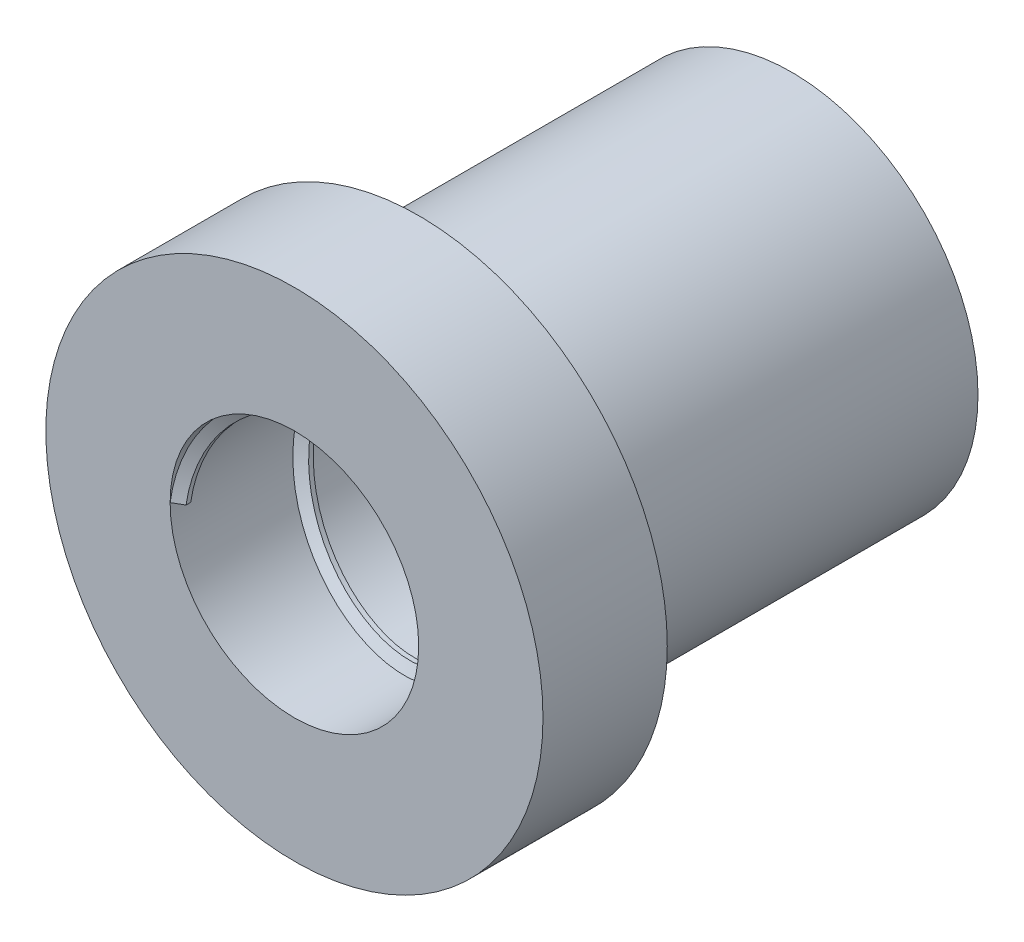
from build123d import *

# Parameters (mm, degrees)
SKETCH1_R               = 15
SKETCH1_R_2             = 10
BOSS_EXTRUDE1_DEPTH     = 30
SKETCH2_R               = 20
SKETCH2_R_2             = 10
BOSS_EXTRUDE2_DEPTH     = 10
THREAD1_PITCH           = 10
CUT_EXTRUDE1_DEPTH      = 16
CUT_EXTRUDE1_DEPTH_BACK = 17
SKETCH5_W               = 2.757537734
SKETCH5_H               = 30


with BuildPart() as part:
    # Sketch1 → Boss-Extrude1 (new body)
    with BuildSketch(Plane.XY):
        Circle(SKETCH1_R)
        Circle(SKETCH1_R_2, mode=Mode.SUBTRACT)
    extrude(amount=BOSS_EXTRUDE1_DEPTH)

    # Sketch2 → Boss-Extrude2 (add)
    with BuildSketch(Plane.XY.offset(30)):
        Circle(SKETCH2_R)
        Circle(SKETCH2_R_2, mode=Mode.SUBTRACT)
    extrude(amount=BOSS_EXTRUDE2_DEPTH)

    # Thread1: the profile of Thread Profile1 profile screwed along a right-hand helix of 4 turns, 16 arcs to a turn; built about Z, then put on its axis
    thread1_z = Axis((0, 0, 0), (0, 0, 1))
    thread1_corners = [(10.0003, 0, -0.000173205), (10.0003, 0, 1.312673201), (9.188101187, 0, 0.843749998), (9.188101187, 0, 0.468749998)]
    with BuildLine(mode=Mode.PRIVATE) as thread1_profile:
        Line(thread1_corners[0], thread1_corners[1])
        Line(thread1_corners[1], thread1_corners[2])
        Line(thread1_corners[2], thread1_corners[3])
        Line(thread1_corners[3], thread1_corners[0])
    thread1_cap = Face(thread1_profile.wire())
    thread1_turn_angles = [0, 11.25, 22.5, 33.75, 45, 56.25, 67.5, 78.75, 90, 101.25, 112.5, 123.75, 135, 146.25, 157.5, 168.75, 180, 191.25, 202.5, 213.75, 225, 236.25, 247.5, 258.75, 270, 281.25, 292.5, 303.75, 315, 326.25, 337.5, 348.75, 360]
    thread1_turn_weights = [1, 0.9807852804032304, 1, 0.9807852804032304, 1, 0.9807852804032304, 1, 0.9807852804032304, 1, 0.9807852804032304, 1, 0.9807852804032304, 1, 0.9807852804032304, 1, 0.9807852804032304, 1, 0.9807852804032304, 1, 0.9807852804032304, 1, 0.9807852804032304, 1, 0.9807852804032304, 1, 0.9807852804032304, 1, 0.9807852804032304, 1, 0.9807852804032304, 1, 0.9807852804032304, 1]
    thread1_turn_rails = [Edge.make_bspline([Vector(p[0], p[1], 0).rotate(thread1_z, thread1_turn_angles[k]) / thread1_turn_weights[k] + Vector(0, 0, p[2] + THREAD1_PITCH * thread1_turn_angles[k] / 360) for k in range(33)], [0, 0, 0, 1, 1, 2, 2, 3, 3, 4, 4, 5, 5, 6, 6, 7, 7, 8, 8, 9, 9, 10, 10, 11, 11, 12, 12, 13, 13, 14, 14, 15, 15, 16, 16, 16], 2, thread1_turn_weights) for p in thread1_corners]
    thread1_turn_sides = [Face.make_surface_from_curves(thread1_turn_rails[p[0]], thread1_turn_rails[p[1]]) for p in [(0, 1), (1, 2), (2, 3), (3, 0)]]
    thread1 = Plane(origin=(0, 0, 40), x_dir=(-1, 0, 0), z_dir=(0, 0, -1)) * Solid(Shell([*[p.moved(Location((0, 0, THREAD1_PITCH * i))) for i in range(4) for p in thread1_turn_sides], thread1_cap, thread1_cap.rotate(thread1_z, 1440).moved(Location((0, 0, THREAD1_PITCH * 1440 / 360)))]))
    add(thread1)

    # Sketch5 → Cut-Extrude1 (cut, two sides: drawn at the far end of the back side and taken through both)
    with BuildSketch(Plane(origin=(0, 0, 0), x_dir=(0, 0, -1), z_dir=(1, 0, 0)).offset(-CUT_EXTRUDE1_DEPTH_BACK)):
        with Locations((1.378768867, 0)):
            Rectangle(SKETCH5_W, SKETCH5_H)
    extrude(amount=CUT_EXTRUDE1_DEPTH + CUT_EXTRUDE1_DEPTH_BACK, mode=Mode.SUBTRACT)


solid = part.part
